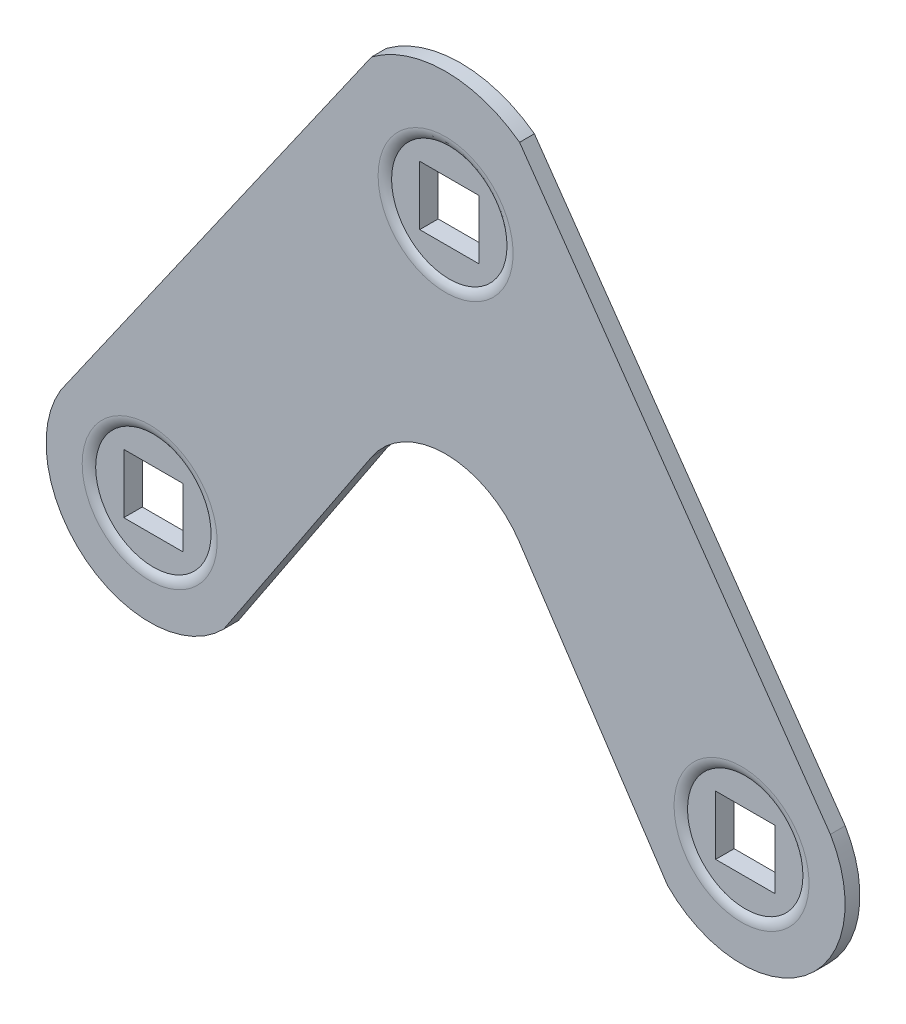
from build123d import *

# Parameters (mm, degrees)
BOSS_EXTRUDE2_DEPTH = 1
SKETCH2_R           = 3.9
CUT_EXTRUDE1_DEPTH  = 0.25
FILLET1_R           = 1
SKETCH5_W           = 4
SKETCH5_H           = 4
CUT_EXTRUDE6_DEPTH  = 2
SKETCH6_R           = 4.25
SKETCH6_W           = 4
SKETCH6_H           = 4
BOSS_EXTRUDE3_DEPTH = 0.5
FILLET2_R           = 1


with BuildPart() as part:
    # Sketch1 → Boss-Extrude2 (new body)
    with BuildSketch(Plane.XY):
        with BuildLine():
            Line((-5, 12.31662479), (-15, -2.758942439))
            ThreePointArc((-15, -2.758942439), (-24.276770595, -3.401554175), (-26.006226146, 5.735207068))
            Line((-26.006226146, 5.735207068), (-5, 35.735207068))
            ThreePointArc((-5, 35.735207068), (0, 37.388266463), (5, 35.735207068))
            Line((5, 35.735207068), (26.006226146, 5.735207068))
            ThreePointArc((26.006226146, 5.735207068), (24.276770595, -3.401554175), (15, -2.758942439))
            Line((15, -2.758942439), (5, 12.31662479))
            ThreePointArc((5, 12.31662479), (0, 15), (-5, 12.31662479))
        make_face()
    extrude(amount=BOSS_EXTRUDE2_DEPTH)

    # Sketch2 → Cut-Extrude1 (cut)
    with BuildSketch(Plane.XY.offset(1)):
        with Locations((-20, 2.140037047)):
            Circle(SKETCH2_R)
        with Locations((20, 2.140037047)):
            Circle(SKETCH2_R)
        with Locations((0, 29)):
            Circle(SKETCH2_R)
    extrude(amount=-CUT_EXTRUDE1_DEPTH, mode=Mode.SUBTRACT)

    # Fillet1
    # the kernel refuses this fillet: 1 mm, written as the material it takes off along each edge
    with BuildSketch(Plane(origin=(-20, 2.140037047, 1), x_dir=(1, 0, 0), z_dir=(0, -1, 0))) as fillet1_piece_1:
        with BuildLine():
            CenterArc((4.561437828, -1), FILLET1_R, 90, 41.409622109)
            Line((3.9, -0.25), (3.886771243, -0.235))
            ThreePointArc((3.886771243, -0.235), (3.88, -0.125), (3.88, 0))
            Line((3.88, 0), (3.9, 0.02))
            Line((3.9, 0.02), (4.561437828, 0.02))
            Line((4.561437828, 0.02), (4.561437828, 0))
        make_face()
    revolve(axis=Axis((-20, 2.140037047, 1), (0, 0, 1)), mode=Mode.SUBTRACT)
    with BuildSketch(Plane(origin=(20, 2.140037047, 1), x_dir=(1, 0, 0), z_dir=(0, -1, 0))) as fillet1_piece_2:
        with BuildLine():
            CenterArc((4.561437828, -1), FILLET1_R, 90, 41.409622109)
            Line((3.9, -0.25), (3.886771243, -0.235))
            ThreePointArc((3.886771243, -0.235), (3.88, -0.125), (3.88, 0))
            Line((3.88, 0), (3.9, 0.02))
            Line((3.9, 0.02), (4.561437828, 0.02))
            Line((4.561437828, 0.02), (4.561437828, 0))
        make_face()
    revolve(axis=Axis((20, 2.140037047, 1), (0, 0, 1)), mode=Mode.SUBTRACT)
    with BuildSketch(Plane(origin=(0, 29, 1), x_dir=(1, 0, 0), z_dir=(0, -1, 0))) as fillet1_piece_3:
        with BuildLine():
            CenterArc((4.561437828, -1), FILLET1_R, 90, 41.409622109)
            Line((3.9, -0.25), (3.886771243, -0.235))
            ThreePointArc((3.886771243, -0.235), (3.88, -0.125), (3.88, 0))
            Line((3.88, 0), (3.9, 0.02))
            Line((3.9, 0.02), (4.561437828, 0.02))
            Line((4.561437828, 0.02), (4.561437828, 0))
        make_face()
    revolve(axis=Axis((0, 29, 1), (0, 0, 1)), mode=Mode.SUBTRACT)

    # Sketch5 → Cut-Extrude6 (cut)
    with BuildSketch(Plane.XY.offset(1)):
        with Locations((0, 29)):
            Rectangle(SKETCH5_W, SKETCH5_H)
        with Locations((20, 2.140037047)):
            Rectangle(SKETCH5_W, SKETCH5_H)
        with Locations((-20, 2.140037047)):
            Rectangle(SKETCH5_W, SKETCH5_H)
    extrude(amount=-CUT_EXTRUDE6_DEPTH, mode=Mode.SUBTRACT)

    # Sketch6 → Boss-Extrude3 (add)
    # profile 1 of 3: a face of its own
    with BuildSketch(Plane(origin=(0, 0, 0), x_dir=(-1, 0, 0), z_dir=(0, 0, -1))):
        with Locations((0, 29)):
            Circle(SKETCH6_R)
        with Locations((0, 29)):
            Rectangle(SKETCH6_W, SKETCH6_H, mode=Mode.SUBTRACT)
    # profile 2 of 3: a face of its own
    with BuildSketch(Plane(origin=(0, 0, 0), x_dir=(-1, 0, 0), z_dir=(0, 0, -1))):
        with Locations((-20, 2.140037047)):
            Circle(SKETCH6_R)
        with Locations((-20, 2.140037047)):
            Rectangle(SKETCH6_W, SKETCH6_H, mode=Mode.SUBTRACT)
    # profile 3 of 3: a face of its own
    with BuildSketch(Plane(origin=(0, 0, 0), x_dir=(-1, 0, 0), z_dir=(0, 0, -1))):
        with Locations((20, 2.140037047)):
            Circle(SKETCH6_R)
        with Locations((20, 2.140037047)):
            Rectangle(SKETCH6_W, SKETCH6_H, mode=Mode.SUBTRACT)
    extrude(amount=BOSS_EXTRUDE3_DEPTH)

    # Fillet2
    # the kernel refuses this fillet: 1 mm, written as the material it takes off along each edge
    with BuildSketch(Plane(origin=(0, 29, -0.5), x_dir=(-1, 0, 0), z_dir=(0, -1, 0))) as fillet2_piece_1:
        with BuildLine():
            CenterArc((3.383974596, -1), FILLET2_R, 30, 60)
            Line((4.25, -0.5), (4.267320508, -0.49))
            ThreePointArc((4.267320508, -0.49), (4.27, -0.25), (4.27, 0))
            Line((4.27, 0), (4.25, 0.02))
            Line((4.25, 0.02), (3.383974596, 0.02))
            Line((3.383974596, 0.02), (3.383974596, 0))
        make_face()
    revolve(axis=Axis((0, 29, -0.5), (0, 0, -1)), mode=Mode.SUBTRACT)
    with BuildSketch(Plane(origin=(20, 2.140037047, -0.5), x_dir=(-1, 0, 0), z_dir=(0, -1, 0))) as fillet2_piece_2:
        with BuildLine():
            CenterArc((3.383974596, -1), FILLET2_R, 30, 60)
            Line((4.25, -0.5), (4.267320508, -0.49))
            ThreePointArc((4.267320508, -0.49), (4.27, -0.25), (4.27, 0))
            Line((4.27, 0), (4.25, 0.02))
            Line((4.25, 0.02), (3.383974596, 0.02))
            Line((3.383974596, 0.02), (3.383974596, 0))
        make_face()
    revolve(axis=Axis((20, 2.140037047, -0.5), (0, 0, -1)), mode=Mode.SUBTRACT)
    with BuildSketch(Plane(origin=(-20, 2.140037047, -0.5), x_dir=(-1, 0, 0), z_dir=(0, -1, 0))) as fillet2_piece_3:
        with BuildLine():
            CenterArc((3.383974596, -1), FILLET2_R, 30, 60)
            Line((4.25, -0.5), (4.267320508, -0.49))
            ThreePointArc((4.267320508, -0.49), (4.27, -0.25), (4.27, 0))
            Line((4.27, 0), (4.25, 0.02))
            Line((4.25, 0.02), (3.383974596, 0.02))
            Line((3.383974596, 0.02), (3.383974596, 0))
        make_face()
    revolve(axis=Axis((-20, 2.140037047, -0.5), (0, 0, -1)), mode=Mode.SUBTRACT)


solid = part.part
